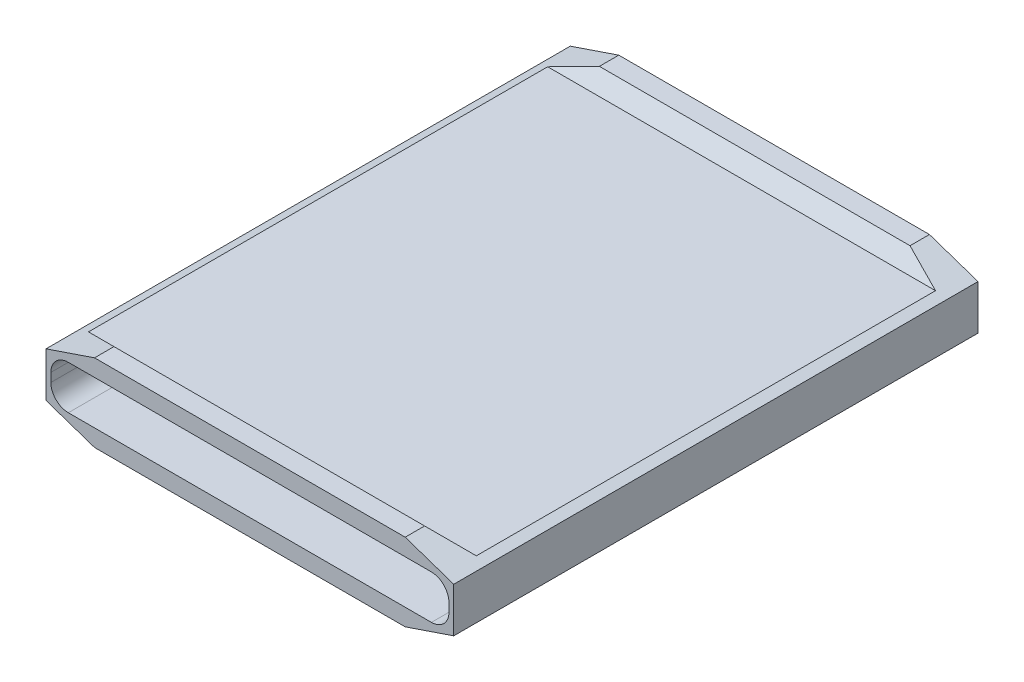
from build123d import *

# Parameters (mm, degrees)
SKETCH1_W            = 42
SKETCH1_H            = 8
SKETCH1_W_2          = 41
SKETCH1_H_2          = 4.5
BOSS_EXTRUDE1_DEPTH  = 54
CUT_EXTRUDE1_REACH   = 60.078
MIRROR2_COPY_1_REACH = 60.078
FILLET1_R            = 1.8
CUT_EXTRUDE2_START   = -2
SKETCH3_OUTSIDE_W    = 57.776
SKETCH3_OUTSIDE_H    = 23.776
SKETCH3_OUTSIDE_W_2  = 42
SKETCH3_OUTSIDE_H_2  = 5.3
CUT_EXTRUDE2_DEPTH   = 50
CHAMFER1_SIZE        = 1.35


with BuildPart() as part:
    # Sketch1 → Boss-Extrude1 (new body)
    with BuildSketch(Plane.XY):
        Rectangle(SKETCH1_W, SKETCH1_H)
        Rectangle(SKETCH1_W_2, SKETCH1_H_2, mode=Mode.SUBTRACT)
    extrude(amount=BOSS_EXTRUDE1_DEPTH)

    # Sketch2 → Cut-Extrude1 (cut, up to next)
    with BuildSketch(Plane.XY.offset(54), mode=Mode.PRIVATE) as cut_extrude1_sk1:
        Polygon((-16, 4), (-21, 2.302178038), (-21, 4), align=None)
    cut_extrude1_tool1 = extrude(cut_extrude1_sk1.sketch, amount=-CUT_EXTRUDE1_REACH, mode=Mode.PRIVATE) & part.part
    cut_extrude1 = cut_extrude1_tool1.solids().sort_by_distance((-19.333333, 3.434059, 54))[0]
    add(cut_extrude1, mode=Mode.SUBTRACT)

    # Mirror1: Cut-Extrude1 across plane
    add(cut_extrude1.mirror(Plane.ZX), mode=Mode.SUBTRACT)

    # Mirror2: Cut-Extrude1 across plane
    add(cut_extrude1.mirror(Plane(origin=(0, 0, 0), x_dir=(0, 0, 1), z_dir=(1, 0, 0))), mode=Mode.SUBTRACT)

    # Mirror2 copy 1 sketch → Mirror2 copy 1 (cut, up to next)
    with BuildSketch(Plane(origin=(0, 0, 54), x_dir=(-1, 0, 0), z_dir=(0, 0, 1)), mode=Mode.PRIVATE) as mirror2_copy_1_sk1:
        Polygon((-16, 4), (-21, 2.302178038), (-21, 4), align=None)
    mirror2_copy_1_tool1 = extrude(mirror2_copy_1_sk1.sketch, amount=-MIRROR2_COPY_1_REACH, mode=Mode.PRIVATE) & part.part
    add(mirror2_copy_1_tool1.solids().sort_by_distance((19.333333, -3.434059, 54))[0], mode=Mode.SUBTRACT)

    # Fillet1
    fillet1_edges = [part.edges().sort_by_distance(p)[0] for p in [
        (-20.5, 2.25, 27),
        (-20.5, -2.25, 27),
        (20.5, -2.25, 27),
        (20.5, 2.25, 27),
    ]]
    fillet(fillet1_edges, radius=FILLET1_R)

    # Sketch3 outside → Cut-Extrude2 (cut)
    with BuildSketch(Plane.XY.offset(54).offset(CUT_EXTRUDE2_START)):
        Rectangle(SKETCH3_OUTSIDE_W, SKETCH3_OUTSIDE_H)
        Rectangle(SKETCH3_OUTSIDE_W_2, SKETCH3_OUTSIDE_H_2, mode=Mode.SUBTRACT)
    extrude(amount=-CUT_EXTRUDE2_DEPTH, mode=Mode.SUBTRACT)

    # Chamfer1
    chamfer1_edges = [part.edges().sort_by_distance(p)[0] for p in [
        (0, -2.65, 2),
        (0, -2.65, 52),
        (0, 2.65, 52),
        (0, 2.65, 2),
    ]]
    chamfer(chamfer1_edges, length=CHAMFER1_SIZE - 0.0001)  # a hair under: the kernel refuses the full size


solid = part.part
